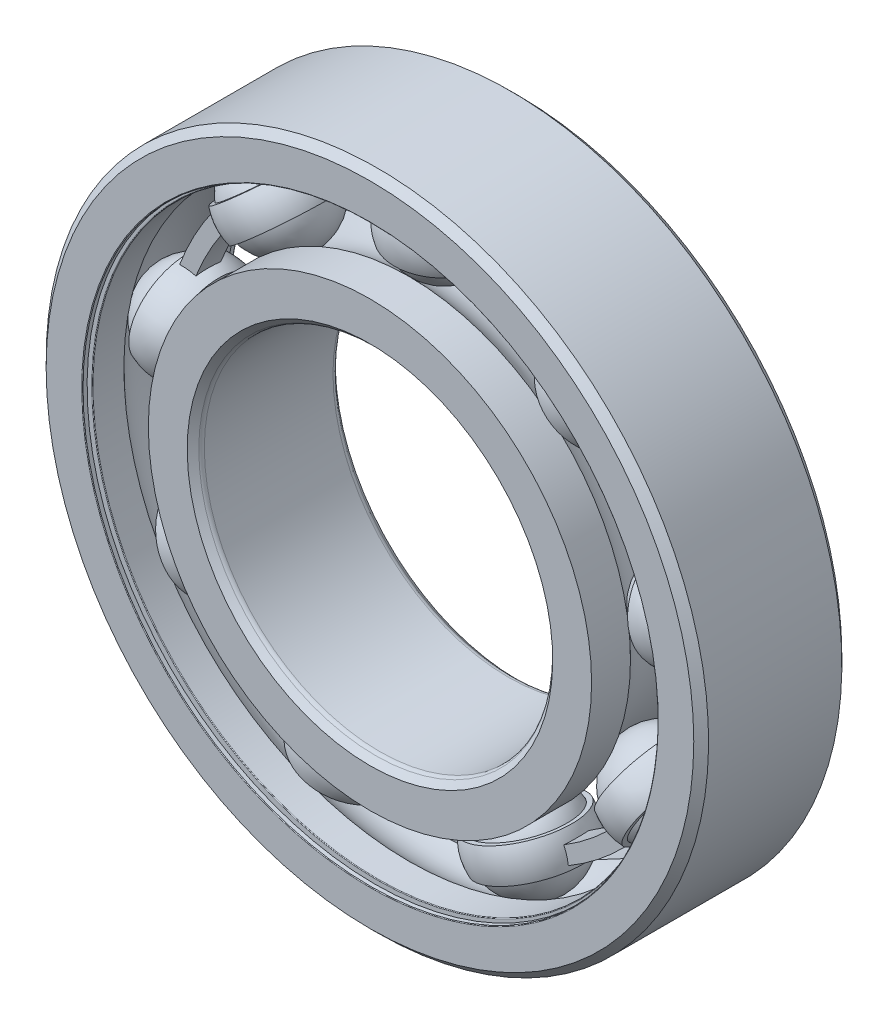
from build123d import *

# Parameters (mm, degrees)
BOSS_EXTRUDE1_DEPTH = 1.583333333
CIRPATTERN1_COUNT   = 9
CIRPATTERN2_COUNT   = 9
FILLET1_R           = 0.0855
FILLET2_R           = 0.7125


with BuildPart() as part:
    # Sketch3 → Revolve1 (revolve)
    with BuildSketch(Plane(origin=(0, 0, 0), x_dir=(0, 0, -1), z_dir=(1, 0, 0)), mode=Mode.PRIVATE) as revolve1_sk:
        with BuildLine():
            Line((8.55, 42.5), (9.5, 41.55))
            Line((9.5, 41.55), (9.5, 36.561288462))
            Line((9.5, 36.561288462), (4.5125, 36.561288462))
            ThreePointArc((4.5125, 36.561288462), (0, 38.570890826), (-4.5125, 36.561288462))
            Line((-4.5125, 36.561288462), (-9.5, 36.561288462))
            Line((-9.5, 36.561288462), (-9.5, 41.55))
            Line((-9.5, 41.55), (-8.55, 42.5))
            Line((-8.55, 42.5), (8.55, 42.5))
        make_face()
    revolve(revolve1_sk.sketch.rotate(Axis((0, 0, 9.5), (0, 0, -1)), 180), axis=Axis((0, 0, 9.5), (0, 0, -1)))

    # Sketch8 → Cut-Revolve1 (revolve, cut)
    with BuildSketch(Plane(origin=(0, 0, 0), x_dir=(0, 0, -1), z_dir=(1, 0, 0)), mode=Mode.PRIVATE) as cut_revolve1_sk:
        Polygon((-8.892, 36.561288462), (-8.55, 36.561288462), (-8.55, 38.540858974), (-8.892, 38.540858974), (-8.892, 36.903288462), (-9.5, 36.903288462), (-9.5, 36.561288462), align=None)
        Polygon((8.55, 36.561288462), (8.892, 36.561288462), (9.5, 36.561288462), (9.5, 36.903288462), (8.892, 36.903288462), (8.892, 38.540858974), (8.55, 38.540858974), align=None)
    revolve(cut_revolve1_sk.sketch.rotate(Axis((0, 0, 9.5), (0, 0, -1)), 180), axis=Axis((0, 0, 9.5), (0, 0, -1)), mode=Mode.SUBTRACT)

    # Fillet1
    fillet1_edges = [part.edges().sort_by_distance(p)[0] for p in [
        (0, 36.903288462, 9.5),
        (0, 36.561288462, 8.55),
        (0, 36.903288462, -9.5),
        (0, 36.561288462, -8.55),
    ]]
    fillet(fillet1_edges, radius=FILLET1_R)


with BuildPart() as body_2:
    # Sketch4 → Revolve2 (revolve)
    with BuildSketch(Plane(origin=(0, 0, 0), x_dir=(0, 0, -1), z_dir=(1, 0, 0)), mode=Mode.PRIVATE) as revolve2_sk:
        with BuildLine():
            Line((-8.55, 22.4995), (-9.5, 23.4495))
            Line((-9.5, 23.4495), (-9.5, 28.438211538))
            Line((-9.5, 28.438211538), (-4.5125, 28.438211538))
            ThreePointArc((-4.5125, 28.438211538), (0, 26.428609174), (4.5125, 28.438211538))
            Line((4.5125, 28.438211538), (9.5, 28.438211538))
            Line((9.5, 28.438211538), (9.5, 23.4495))
            Line((9.5, 23.4495), (8.55, 22.4995))
            Line((8.55, 22.4995), (-8.55, 22.4995))
        make_face()
    revolve(revolve2_sk.sketch.rotate(Axis((0, 0, 9.5), (0, 0, -1)), 180), axis=Axis((0, 0, 9.5), (0, 0, -1)))

    # Fillet2
    fillet2_edges = [body_2.edges().sort_by_distance(p)[0] for p in [
        (0, 22.4995, 8.55),
        (0, 22.4995, -8.55),
    ]]
    fillet(fillet2_edges, radius=FILLET2_R)


with BuildPart() as body_3:
    # Sketch5 → Revolve3 (revolve)
    with BuildSketch(Plane(origin=(0, 0, 0), x_dir=(0, 0, -1), z_dir=(1, 0, 0))):
        with BuildLine():
            Line((-6.071140826, 32.49975), (6.071140826, 32.49975))
            ThreePointArc((6.071140826, 32.49975), (0, 38.570890826), (-6.071140826, 32.49975))
        make_face()
    revolve(axis=Axis((0, 32.49975, 6.071140826), (0, 0, -1)))


with BuildPart() as body_4:
    # Sketch6 → Revolve4 (revolve)
    with BuildSketch(Plane(origin=(0, 0, 0), x_dir=(0, 0, -1), z_dir=(1, 0, 0))):
        with BuildLine():
            Line((-5.72142703, 34.530519231), (-6.351189191, 34.530519231))
            ThreePointArc((-6.351189191, 34.530519231), (-6.666070272, 32.49975), (-6.351189191, 30.468980769))
            Line((-6.351189191, 30.468980769), (-5.72142703, 30.468980769))
            ThreePointArc((-5.72142703, 30.468980769), (-6.071140826, 32.49975), (-5.72142703, 34.530519231))
        make_face()
    revolve4 = revolve(axis=Axis((0, 42.5, 0), (0, -1, 0)))

    # Sketch7 → Boss-Extrude1 (add, symmetric)
    with BuildSketch(Plane.XY):
        with BuildLine():
            Line((20.890436618, 24.89625289), (22.195789918, 26.451912375))
            ThreePointArc((22.195789918, 26.451912375), (11.810133136, 32.448074113), (0, 34.530519231))
            Line((0, 34.530519231), (0, 32.49975))
            ThreePointArc((0, 32.49975), (11.115569153, 30.539775252), (20.890436618, 24.89625289))
        make_face()
    boss_extrude1 = extrude(amount=BOSS_EXTRUDE1_DEPTH, both=True)

    # CirPattern2: Revolve4, Boss-Extrude1 ×9 about axis
    cirpattern2_axis = Axis((0, 0, 0), (0, 0, 1))
    add([revolve4.rotate(cirpattern2_axis, i * 360 / CIRPATTERN2_COUNT) for i in range(1, CIRPATTERN2_COUNT)])
    add([boss_extrude1.rotate(cirpattern2_axis, i * 360 / CIRPATTERN2_COUNT) for i in range(1, CIRPATTERN2_COUNT)])


with BuildPart() as cirpattern1_1:
    # CirPattern1: pattern copy
    add(body_3.part.rotate(Axis((0, 0, 0), (0, 0, 1)), 1 * 360 / CIRPATTERN1_COUNT))


with BuildPart() as cirpattern1_2:
    # CirPattern1: pattern copy
    add(body_3.part.rotate(Axis((0, 0, 0), (0, 0, 1)), 2 * 360 / CIRPATTERN1_COUNT))


with BuildPart() as cirpattern1_3:
    # CirPattern1: pattern copy
    add(body_3.part.rotate(Axis((0, 0, 0), (0, 0, 1)), 3 * 360 / CIRPATTERN1_COUNT))


with BuildPart() as cirpattern1_4:
    # CirPattern1: pattern copy
    add(body_3.part.rotate(Axis((0, 0, 0), (0, 0, 1)), 4 * 360 / CIRPATTERN1_COUNT))


with BuildPart() as cirpattern1_5:
    # CirPattern1: pattern copy
    add(body_3.part.rotate(Axis((0, 0, 0), (0, 0, 1)), 5 * 360 / CIRPATTERN1_COUNT))


with BuildPart() as cirpattern1_6:
    # CirPattern1: pattern copy
    add(body_3.part.rotate(Axis((0, 0, 0), (0, 0, 1)), 6 * 360 / CIRPATTERN1_COUNT))


with BuildPart() as cirpattern1_7:
    # CirPattern1: pattern copy
    add(body_3.part.rotate(Axis((0, 0, 0), (0, 0, 1)), 7 * 360 / CIRPATTERN1_COUNT))


with BuildPart() as cirpattern1_8:
    # CirPattern1: pattern copy
    add(body_3.part.rotate(Axis((0, 0, 0), (0, 0, 1)), 8 * 360 / CIRPATTERN1_COUNT))


solid = Compound([part.part, body_2.part, body_3.part, body_4.part, cirpattern1_1.part, cirpattern1_2.part, cirpattern1_3.part, cirpattern1_4.part, cirpattern1_5.part, cirpattern1_6.part, cirpattern1_7.part, cirpattern1_8.part])
